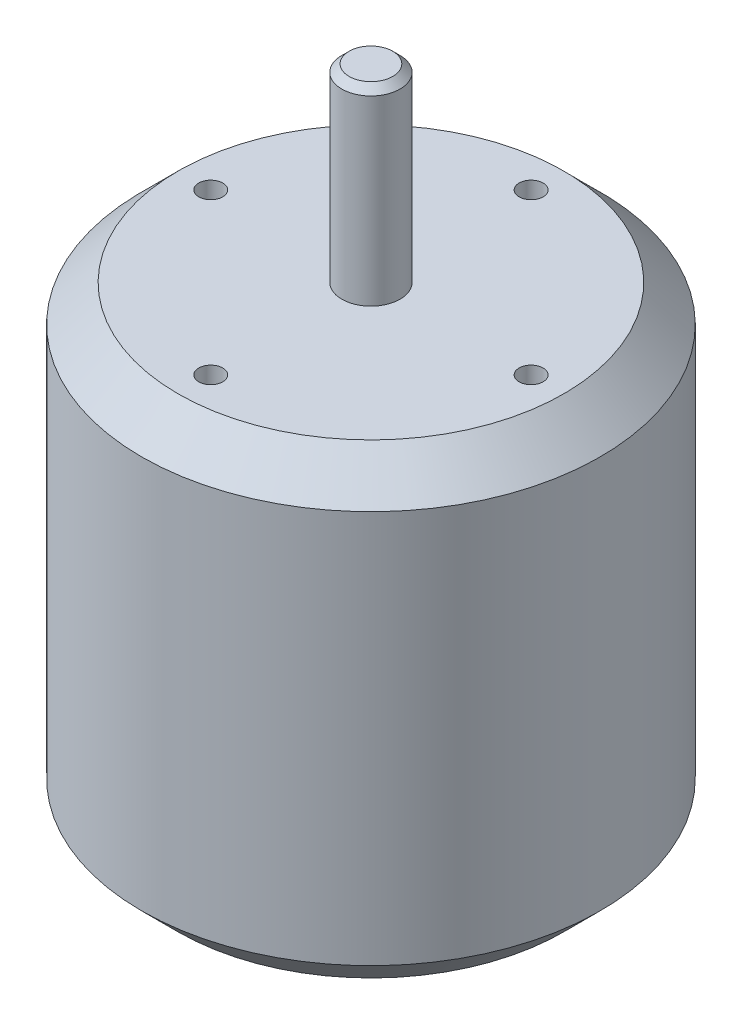
from build123d import *

# Parameters (mm, degrees)
SKETCH1_R               = 31.5
BOSS_EXTRUDE1_DEPTH     = 64
SKETCH2_R               = 4
BOSS_EXTRUDE2_DEPTH     = 26
CHAMFER3_SIZE           = 1
CUT_EXTRUDE1_REACH      = 102.422
CUT_EXTRUDE1_END_RADIUS = 4
SKETCH3_W               = 3
SKETCH3_H               = 19
FILLET1_R               = 1.5
CIRPATTERN2_COUNT       = 4
CHAMFER4_SIZE           = 5
SKETCH11_R              = 13
BOSS_EXTRUDE3_DEPTH     = 7
CHAMFER5_SIZE           = 1


with BuildPart() as part:
    # Sketch1 → Boss-Extrude1 (new body)
    with BuildSketch(Plane(origin=(0, 0, 0), x_dir=(1, 0, 0), z_dir=(0, 1, 0))):
        with Locations(Location((0, 0, 0), (0, 0, 270))):
            Circle(SKETCH1_R)
    extrude(amount=BOSS_EXTRUDE1_DEPTH)

    # Sketch2 → Boss-Extrude2 (add)
    with BuildSketch(Plane(origin=(0, 64, 0), x_dir=(1, 0, 0), z_dir=(0, 1, 0))):
        with Locations(Location((0, 0, 0), (0, 0, 90))):
            Circle(SKETCH2_R)
    extrude(amount=BOSS_EXTRUDE2_DEPTH)

    # Chamfer3
    chamfer3_edges = [part.edges().sort_by_distance(p)[0] for p in [
        (0, 90, 4),
    ]]
    chamfer(chamfer3_edges, length=CHAMFER3_SIZE)

    # Cut-Extrude1: up to this cylinder (the profile starts inside it)
    cut_extrude1_end = Plane(origin=(0, 77, 0), z_dir=(0, -1, 0)) * Cylinder(CUT_EXTRUDE1_END_RADIUS, 213.844, mode=Mode.PRIVATE)
    # Sketch3 → Cut-Extrude1 (cut, up to the surface)
    with BuildSketch(Plane(origin=(0, 0, 0), x_dir=(0, 0, -1), z_dir=(1, 0, 0)), mode=Mode.PRIVATE) as cut_extrude1_sk1:
        with Locations((0, 77)):
            Rectangle(SKETCH3_W, SKETCH3_H)
    cut_extrude1_tool1 = extrude(cut_extrude1_sk1.sketch, amount=-CUT_EXTRUDE1_REACH, mode=Mode.PRIVATE) & cut_extrude1_end
    add(cut_extrude1_tool1.solids().sort_by_distance((0, 77, 0))[0], mode=Mode.SUBTRACT)

    # Fillet1
    fillet1_edges = [part.edges().sort_by_distance(p)[0] for p in [
        (-1.854049622, 67.5, -1.5),
        (-1.854049622, 67.5, 1.5),
        (-1.854049622, 86.5, -1.5),
        (-1.854049622, 86.5, 1.5),
    ]]
    fillet(fillet1_edges, radius=FILLET1_R - 0.0001)  # a hair under: the kernel refuses the full size

    # Sketch10 → M4 Tapped Hole1 (revolve, cut)
    with BuildSketch(Plane(origin=(0, 64, -22), x_dir=(0, 0, 1), z_dir=(1, 0, 0))):
        Polygon((0, 0), (0, 13.091420021), (1.65, 12.1), (1.65, 0), align=None)
    m4_tapped_hole1 = revolve(axis=Axis((0, 70.35, -22), (0, -1, 0)), mode=Mode.SUBTRACT)

    # CirPattern2: M4 Tapped Hole1 ×4 about axis
    cirpattern2_axis = Axis((0, 0, 0), (0, 1, 0))
    for i in range(1, CIRPATTERN2_COUNT):
        add(m4_tapped_hole1.rotate(cirpattern2_axis, i * 360 / CIRPATTERN2_COUNT), mode=Mode.SUBTRACT)

    # Chamfer4
    chamfer4_edges = [part.edges().sort_by_distance(p)[0] for p in [
        (0, 0, -31.5),
        (0, 64, -31.5),
    ]]
    chamfer(chamfer4_edges, length=CHAMFER4_SIZE)

    # Sketch11 → Boss-Extrude3 (add)
    with BuildSketch(Plane(origin=(0, 0, 0), x_dir=(-1, 0, 0), z_dir=(0, -1, 0))):
        with Locations(Location((0, 0, 0), (0, 0, 270))):
            Circle(SKETCH11_R)
    extrude(amount=BOSS_EXTRUDE3_DEPTH)

    # Chamfer5
    chamfer5_edges = [part.edges().sort_by_distance(p)[0] for p in [
        (0, -7, -13),
    ]]
    chamfer(chamfer5_edges, length=CHAMFER5_SIZE)


solid = part.part
